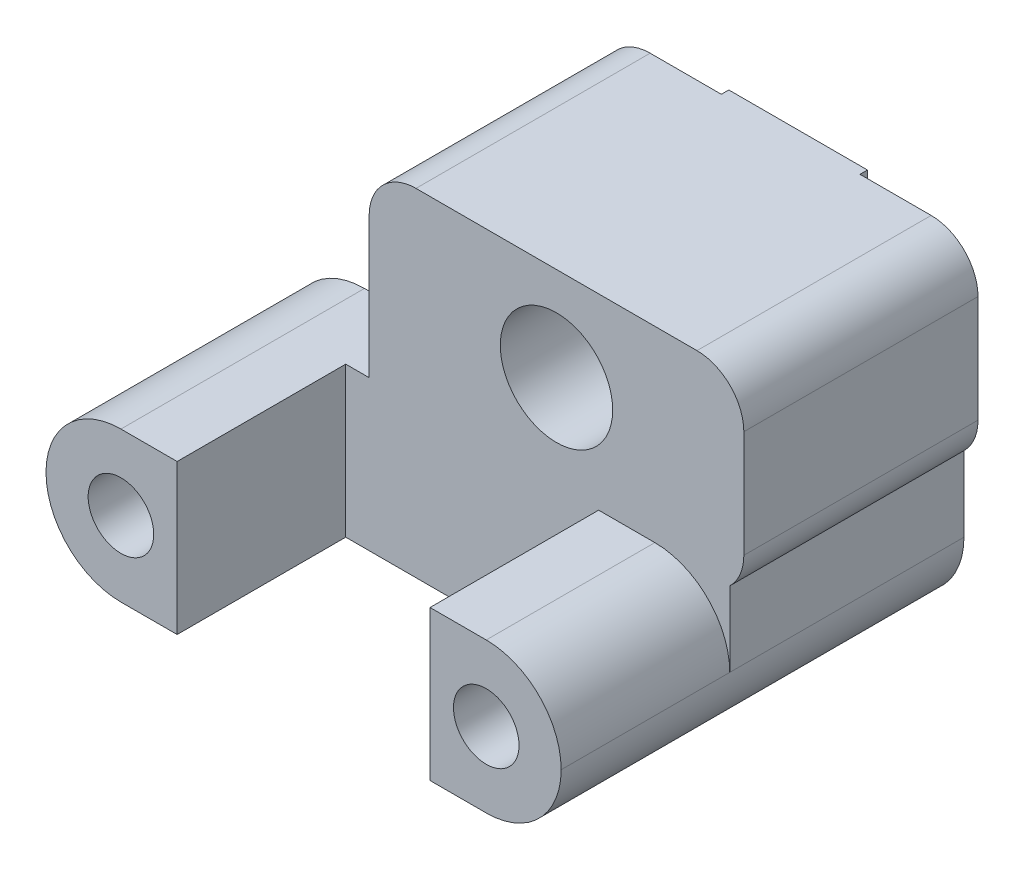
from build123d import *

# Parameters (mm, degrees)
SKETCH_1_W               = 20
SKETCH_1_H               = 10
EXTRUDE_1_DEPTH          = 8.5
EXTRUDE_3_DEPTH          = 8.5
EXTRUDE_3_DEPTH_BACK     = 13
CUT_EXTRUDE_1_DEPTH      = 9
SKETCH_11_W              = 7.4
SKETCH_11_H              = 18
EXTRUDE_5_DEPTH          = 0.4
SKETCH_14_W              = 13
SKETCH_14_H              = 8.5
CUT_EXTRUDE_7_DEPTH      = 8
SKETCH_6_R               = 1.75
CUT_EXTRUDE_2_DEPTH      = 12.8
CUT_EXTRUDE_3_DEPTH      = 35.441980199
CUT_EXTRUDE_3_DEPTH_BACK = 12.9
SKETCH_15_W              = 3.5
SKETCH_15_H              = 8
CUT_EXTRUDE_8_DEPTH      = 8.5
SKETCH_12_R              = 1.6
CUT_EXTRUDE_4_DEPTH      = 35.693082884
SKETCH_13_R              = 3
CUT_EXTRUDE_5_DEPTH      = 4.5
FILLET_1_R               = 2.5
FILLET_2_R               = 4


# Some blends are built 0.0001 mm under size
with BuildPart() as part:
    # Эскиз1 → Бобышка-Вытянуть1 (new body)
    with BuildSketch(Plane.XY):
        with Locations((10, -5)):
            Rectangle(SKETCH_1_W, SKETCH_1_H)
    extrude(amount=EXTRUDE_1_DEPTH)

    # Эскиз4 → Бобышка-Вытянуть3 (add, two sides: drawn at the far end of the back side and taken through both)
    with BuildSketch(Plane(origin=(0, 0, 8.5), x_dir=(-1, 0, 0), z_dir=(0, 0, -1)).offset(-EXTRUDE_3_DEPTH_BACK)):
        with BuildLine():
            Line((4.25, -10), (0, -10))
            Line((0, -10), (0, 0))
            Line((0, 0), (-20, 0))
            Line((-20, 0), (-20, -10))
            Line((-20, -10), (-19.25, -10))
            Line((-19.25, -10), (-19.25, -14))
            ThreePointArc((-19.25, -14), (-18.078427125, -16.828427125), (-15.25, -18))
            Line((-15.25, -18), (4.25, -18))
            ThreePointArc((4.25, -18), (8.25, -14), (4.25, -10))
        make_face()
    extrude(amount=EXTRUDE_3_DEPTH + EXTRUDE_3_DEPTH_BACK)

    # Эскиз5 → Вырез-Вытянуть1 (cut)
    with BuildSketch(Plane.XY.offset(21.5)):
        Polygon((-1.25, -10), (-1.25, -18), (12.25, -18), (12.25, -10), (20, -10), (20, 0), (0, 0), (0, -10), align=None)
    extrude(amount=-CUT_EXTRUDE_1_DEPTH, mode=Mode.SUBTRACT)

    # Эскиз11 → Бобышка-Вытянуть5 (add)
    with BuildSketch(Plane(origin=(0, 0, 0), x_dir=(-1, 0, 0), z_dir=(0, 0, -1))):
        with Locations((-10, -9)):
            Rectangle(SKETCH_11_W, SKETCH_11_H)
    extrude(amount=EXTRUDE_5_DEPTH)

    # Эскиз14 → Вырез-Вытянуть7 (cut)
    with BuildSketch(Plane(origin=(9.75, -18, 0), x_dir=(-1, 0, 0), z_dir=(0, 1, 0))):
        with Locations((19.75, 4.25)):
            Rectangle(SKETCH_14_W, SKETCH_14_H)
    extrude(amount=CUT_EXTRUDE_7_DEPTH, mode=Mode.SUBTRACT)

    # Эскиз6 → Вырез-Вытянуть2 (cut)
    with BuildSketch(Plane.XY.offset(21.5)):
        with Locations((-4.25, -14)):
            Circle(SKETCH_6_R)
        with Locations((15.25, -14)):
            Circle(SKETCH_6_R)
    extrude(amount=-CUT_EXTRUDE_2_DEPTH, mode=Mode.SUBTRACT)

    # Эскиз7 → Вырез-Вытянуть3 (cut, two sides: drawn at the far end of the back side and taken through both)
    with BuildSketch(Plane(origin=(0, 0, 0), x_dir=(-1, 0, 0), z_dir=(0, 0, -1)).offset(-CUT_EXTRUDE_3_DEPTH_BACK)):
        Polygon((-15.25, -10.766838493), (-18.05, -12.383419246), (-18.05, -15.616580754), (-15.25, -17.233161507), (-12.45, -15.616580754), (-12.45, -12.383419246), align=None)
        Polygon((4.25, -10.766838493), (1.45, -12.383419246), (1.45, -15.616580754), (4.25, -17.233161507), (7.05, -15.616580754), (7.05, -12.383419246), align=None)
    extrude(amount=CUT_EXTRUDE_3_DEPTH + CUT_EXTRUDE_3_DEPTH_BACK, mode=Mode.SUBTRACT)

    # Эскиз15 → Вырез-Вытянуть8 (cut)
    with BuildSketch(Plane(origin=(0, 0, 0), x_dir=(-1, 0, 0), z_dir=(0, 0, -1))):
        with Locations((1.75, -14)):
            Rectangle(SKETCH_15_W, SKETCH_15_H)
    extrude(amount=-CUT_EXTRUDE_8_DEPTH, mode=Mode.SUBTRACT)

    # Эскиз12 → Вырез-Вытянуть4 (cut, through all)
    with BuildSketch(Plane(origin=(0, 0, -0.4), x_dir=(-1, 0, 0), z_dir=(0, 0, -1))):
        with Locations((-10, -5)):
            Circle(SKETCH_12_R)
    extrude(amount=-CUT_EXTRUDE_4_DEPTH, mode=Mode.SUBTRACT)

    # Эскиз13 → Вырез-Вытянуть5 (cut)
    with BuildSketch(Plane.XY.offset(12.5)):
        with Locations((10, -5)):
            Circle(SKETCH_13_R)
    extrude(amount=-CUT_EXTRUDE_5_DEPTH, mode=Mode.SUBTRACT)

    # Скругление1
    # the kernel refuses this fillet: 2.5 mm, written as the material it takes off along each edge
    with BuildSketch(Plane(origin=(0, 0, -6.25), x_dir=(1, 0, 0), z_dir=(0, 0, 1)), Plane(origin=(20, 0, 18.75), x_dir=(-1, 0, 0), z_dir=(0, 0, -1))) as fillet_1_piece_1:
        with BuildLine():
            CenterArc((FILLET_1_R, -FILLET_1_R), FILLET_1_R, 90, 90)
            Line((0, -FILLET_1_R), (-FILLET_1_R * 0.02, -FILLET_1_R))
            Line((-FILLET_1_R * 0.02, -FILLET_1_R), (-FILLET_1_R * 0.02, FILLET_1_R * 0.02))
            Line((-FILLET_1_R * 0.02, FILLET_1_R * 0.02), (FILLET_1_R, FILLET_1_R * 0.02))
            Line((FILLET_1_R, FILLET_1_R * 0.02), (FILLET_1_R, 0))
        make_face()
    extrude(amount=25, mode=Mode.SUBTRACT)
    with BuildSketch(Plane(origin=(20, -10, 16.963392768), x_dir=(0, 1, 0), z_dir=(0, 0, -1))) as fillet_1_piece_2:
        with BuildLine():
            CenterArc((1.785357107, -2.5), FILLET_1_R, 90, 45.572995999)
            Line((0, -0.75), (-0.035707142, -0.715))
            ThreePointArc((-0.035707142, -0.715), (-0.05, -0.375), (-0.05, 0))
            Line((-0.05, 0), (0, 0.05))
            Line((0, 0.05), (1.785357107, 0.05))
            Line((1.785357107, 0.05), (1.785357107, 0))
        make_face()
    extrude(amount=21.426785536, mode=Mode.SUBTRACT)

    # Скругление2
    fillet_2_edges = [part.edges().sort_by_distance(p)[0] for p in [
        (19.25, -10, 17),
    ]]
    fillet(fillet_2_edges, radius=FILLET_2_R - 0.0001)  # a hair under: the kernel refuses the full size


solid = part.part
